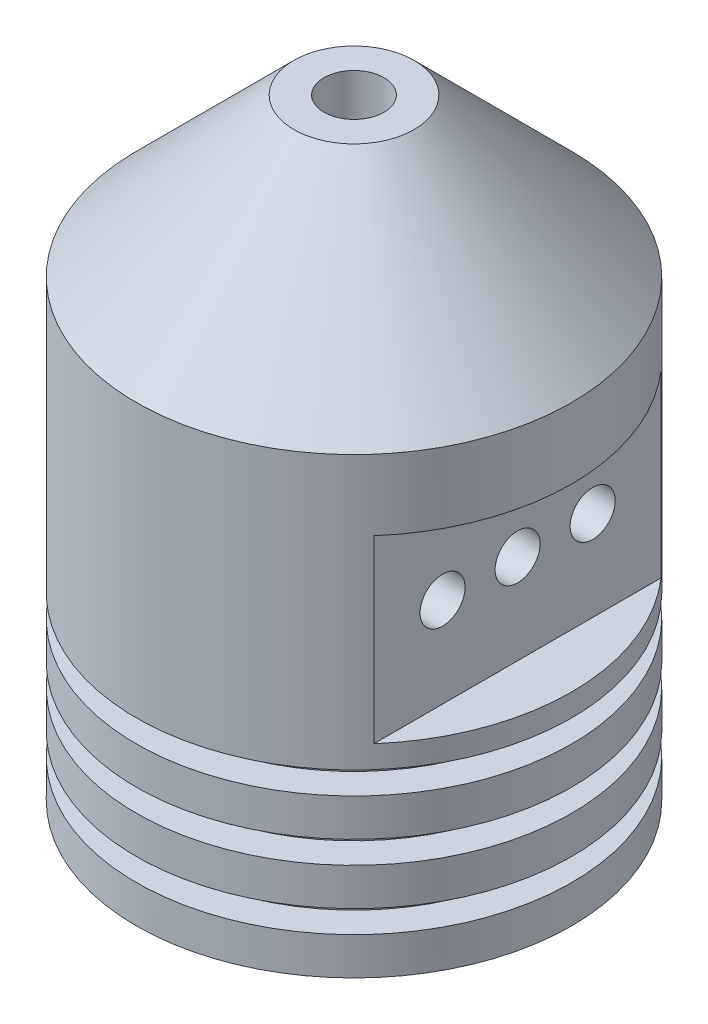
from build123d import *

# Parameters (mm, degrees)
SKETCH_1_R               = 14.5
EXTRUDE_1_DEPTH          = 41.7
CHAMFER_1_SIZE           = 10.5
SKETCH_2_R               = 2
CUT_EXTRUDE_1_DEPTH      = 47.469237136
CHAMFER_2_SIZE           = 5
CHAMFER_2_SIZE2          = 1
SKETCH_3_W               = 2
SKETCH_3_H               = 1.5
CUT_EXTRUDE_2_DEPTH      = 47.469237136
CUT_EXTRUDE_2_DEPTH_BACK = 47.469237136
SKETCH_5_W               = 6.979253001
SKETCH_5_H               = 12
SKETCH_6_R               = 8.65
CUT_EXTRUDE_3_DEPTH      = 5.6
CHAMFER_3_SIZE           = 0.5
SKETCH_7_R               = 8.15
CUT_EXTRUDE_4_DEPTH      = 15.6
CHAMFER_4_SIZE           = 0.5
SKETCH_8_R               = 7
CUT_EXTRUDE_5_DEPTH      = 17.5
CUT_EXTRUDE_6_DEPTH      = 8
CUT_EXTRUDE_7_DEPTH      = 8
SKETCH_10_R              = 1.5
CUT_EXTRUDE_8_DEPTH      = 7


with BuildPart() as part:
    # 草图1 → 凸台-拉伸1 (new body)
    with BuildSketch(Plane(origin=(0, 0, 0), x_dir=(1, 0, 0), z_dir=(0, 1, 0))):
        with Locations(Location((0, 0, 0), (0, 0, 270))):
            Circle(SKETCH_1_R)
    extrude(amount=EXTRUDE_1_DEPTH)

    # 倒角1
    chamfer_1_edges = [part.edges().sort_by_distance(p)[0] for p in [
        (0, 41.7, -14.5),
    ]]
    chamfer(chamfer_1_edges, length=CHAMFER_1_SIZE)

    # 草图2 → 切除-拉伸1 (cut, through all)
    with BuildSketch(Plane(origin=(0, 41.7, 0), x_dir=(1, 0, 0), z_dir=(0, 1, 0))):
        with Locations(Location((0, 0, 0), (0, 0, 270))):
            Circle(SKETCH_2_R)
    extrude(amount=-CUT_EXTRUDE_1_DEPTH, mode=Mode.SUBTRACT)

    # 倒角2
    chamfer_2_edges = [part.edges().sort_by_distance(p)[0] for p in [
        (0, 0, -14.5),
    ]]
    chamfer_2_side = [part.faces().sort_by_distance(p)[0] for p in [
        (0, 0, -14.089878067),
    ]]
    chamfer(chamfer_2_edges, length=CHAMFER_2_SIZE, length2=CHAMFER_2_SIZE2, reference=chamfer_2_side[0])

    # 草图3 → 切除-旋转1 (revolve, cut)
    with BuildSketch(Plane.XY, mode=Mode.PRIVATE) as cut_revolve_1_sk:
        with Locations((13.5, 4.25)):
            Rectangle(SKETCH_3_W, SKETCH_3_H)
        with Locations((13.5, 8.25)):
            Rectangle(SKETCH_3_W, SKETCH_3_H)
        with Locations((13.5, 12.25)):
            Rectangle(SKETCH_3_W, SKETCH_3_H)
    revolve(cut_revolve_1_sk.sketch.rotate(Axis((0, 0, 0), (0, 1, 0)), 90), axis=Axis((0, 0, 0), (0, 1, 0)), mode=Mode.SUBTRACT)

    # 草图5 → 切除-拉伸2 (cut, two sides: drawn at the far end of the back side and taken through both)
    with BuildSketch(Plane.XY.offset(-CUT_EXTRUDE_2_DEPTH_BACK)):
        with Locations((14.389626501, 20.5)):
            Rectangle(SKETCH_5_W, SKETCH_5_H)
    extrude(amount=CUT_EXTRUDE_2_DEPTH + CUT_EXTRUDE_2_DEPTH_BACK, mode=Mode.SUBTRACT)

    # 草图6 → 切除-拉伸3 (cut)
    with BuildSketch(Plane.XZ):
        with Locations(Location((0, 0, 0), (0, 0, 270))):
            Circle(SKETCH_6_R)
    extrude(amount=-CUT_EXTRUDE_3_DEPTH, mode=Mode.SUBTRACT)

    # 倒角3
    chamfer_3_edges = [part.edges().sort_by_distance(p)[0] for p in [
        (0, 0, 8.65),
    ]]
    chamfer(chamfer_3_edges, length=CHAMFER_3_SIZE)

    # 草图7 → 切除-拉伸4 (cut)
    with BuildSketch(Plane.XZ):
        with Locations(Location((0, 0, 0), (0, 0, 270))):
            Circle(SKETCH_7_R)
    extrude(amount=-CUT_EXTRUDE_4_DEPTH, mode=Mode.SUBTRACT)

    # 倒角4
    chamfer_4_edges = [part.edges().sort_by_distance(p)[0] for p in [
        (0, 5.6, 8.15),
    ]]
    chamfer(chamfer_4_edges, length=CHAMFER_4_SIZE - 0.0001)  # a hair under: the kernel refuses the full size

    # 草图8 → 切除-拉伸5 (cut)
    with BuildSketch(Plane.XZ):
        with Locations(Location((0, 0, 0), (0, 0, 270))):
            Circle(SKETCH_8_R)
    extrude(amount=-CUT_EXTRUDE_5_DEPTH, mode=Mode.SUBTRACT)

    # 草图9 → 切除-拉伸6 (cut)
    with BuildSketch(Plane(origin=(10.9, 0, 0), x_dir=(0, 0, -1), z_dir=(1, 0, 0))):
        with BuildLine():
            ThreePointArc((-3.5, 20.5), (-5, 22), (-6.5, 20.5))
            Line((-6.5, 20.5), (-3.5, 20.5))
        make_face()
        with BuildLine():
            Line((-3.5, 20.5), (-6.5, 20.5))
            ThreePointArc((-6.5, 20.5), (-5, 19), (-3.5, 20.5))
        make_face()
        with BuildLine():
            ThreePointArc((6.5, 20.5), (5, 22), (3.5, 20.5))
            Line((3.5, 20.5), (6.5, 20.5))
        make_face()
        with BuildLine():
            Line((6.5, 20.5), (3.5, 20.5))
            ThreePointArc((3.5, 20.5), (5, 19), (6.5, 20.5))
        make_face()
    extrude(amount=-CUT_EXTRUDE_6_DEPTH, mode=Mode.SUBTRACT)

    # 草图9<3> → 切除-拉伸7 (cut)
    with BuildSketch(Plane(origin=(10.9, 0, 0), x_dir=(0, 0, -1), z_dir=(1, 0, 0))):
        with BuildLine():
            ThreePointArc((1.5, 20.5), (0, 22), (-1.5, 20.5))
            Line((-1.5, 20.5), (1.5, 20.5))
        make_face()
        with BuildLine():
            Line((1.5, 20.5), (-1.5, 20.5))
            ThreePointArc((-1.5, 20.5), (0, 19), (1.5, 20.5))
        make_face()
    extrude(amount=-CUT_EXTRUDE_7_DEPTH, mode=Mode.SUBTRACT)

    # 草图10 → 切除-拉伸8 (cut)
    with BuildSketch(Plane.XZ.offset(-17.5)):
        with Locations(Location((4.5, 0, 0), (0, 0, 270))):
            Circle(SKETCH_10_R)
    extrude(amount=-CUT_EXTRUDE_8_DEPTH, mode=Mode.SUBTRACT)


solid = part.part
